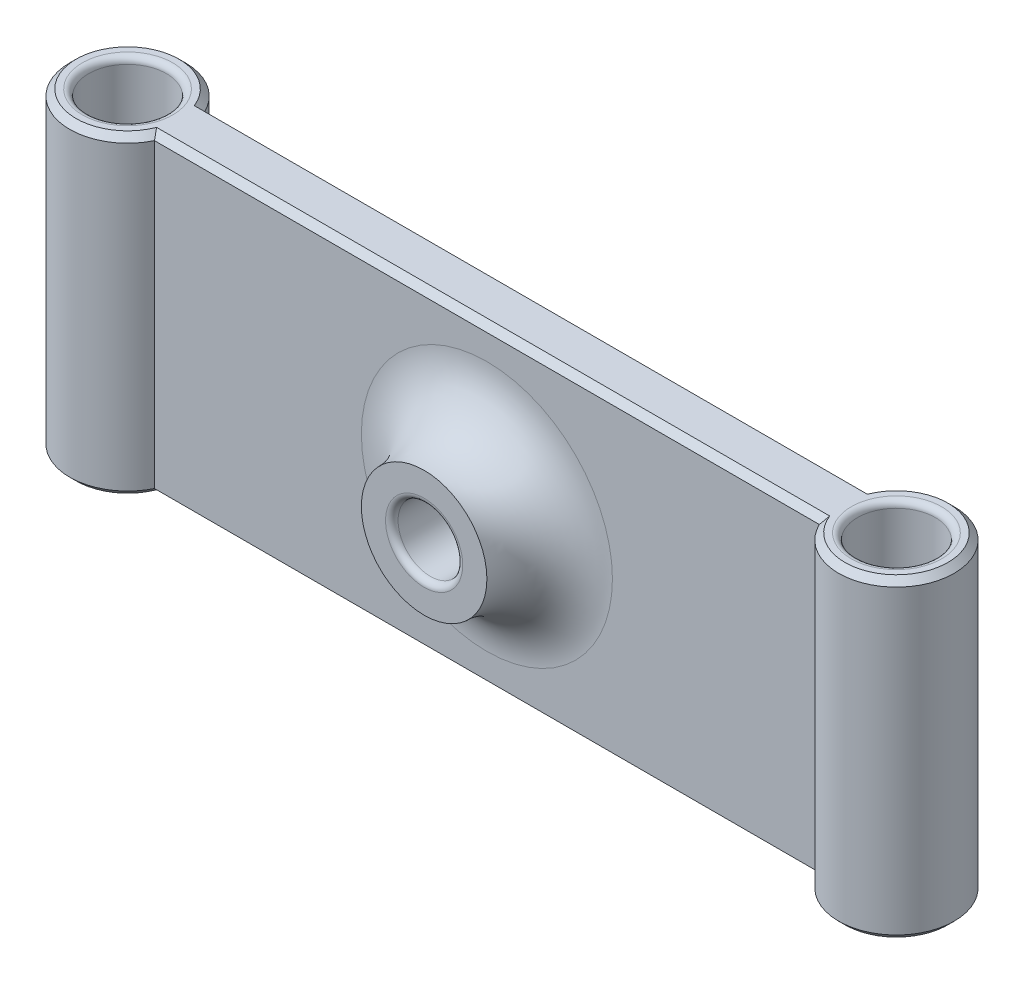
from build123d import *

# Parameters (mm, degrees)
SKETCH1_R                = 6.2
BOSS_EXTRUDE1_DEPTH      = 50
BOSS_EXTRUDE2_DEPTH      = 10
BOSS_EXTRUDE2_DEPTH_BACK = 15
SKETCH2_R                = 10
SKETCH2_R_2              = 5.15
SKETCH3_R                = 5.15
CUT_EXTRUDE2_DEPTH       = 10
FILLET1_R                = 10
FILLET2_R                = 1
CHAMFER1_SIZE            = 1


with BuildPart() as part:
    # Sketch1 → Boss-Extrude1 (new body)
    with BuildSketch(Plane(origin=(0, 0, 0), x_dir=(1, 0, 0), z_dir=(0, 1, 0))):
        with BuildLine():
            Line((-52.965073929, 4), (52.965073929, 4))
            ThreePointArc((52.965073929, 4), (70.45, 0), (52.965073929, -4))
            Line((52.965073929, -4), (-52.965073929, -4))
            ThreePointArc((-52.965073929, -4), (-70.45, 0), (-52.965073929, 4))
        make_face()
        with Locations(Location((-61.25, 0, 0), (0, 0, 270))):
            Circle(SKETCH1_R, mode=Mode.SUBTRACT)
        with Locations(Location((61.25, 0, 0), (0, 0, 90))):
            Circle(SKETCH1_R, mode=Mode.SUBTRACT)
    extrude(amount=BOSS_EXTRUDE1_DEPTH)

    # Sketch2 → Boss-Extrude2 (add, two sides: drawn at the far end of the back side and taken through both)
    with BuildSketch(Plane.XY.offset(4).offset(-BOSS_EXTRUDE2_DEPTH_BACK)):
        with Locations((0, 25)):
            Circle(SKETCH2_R)
        with Locations((0, 25)):
            Circle(SKETCH2_R_2, mode=Mode.SUBTRACT)
    extrude(amount=BOSS_EXTRUDE2_DEPTH + BOSS_EXTRUDE2_DEPTH_BACK)

    # Sketch3 → Cut-Extrude2 (cut)
    with BuildSketch(Plane.XY.offset(4)):
        with Locations((0, 25)):
            Circle(SKETCH3_R)
    extrude(amount=-CUT_EXTRUDE2_DEPTH, mode=Mode.SUBTRACT)

    # Fillet1
    # the kernel refuses this fillet: 10 mm, written as the material it adds along each edge
    with BuildSketch(Plane(origin=(0, 25, 4), x_dir=(1, 0, 0), z_dir=(0, -1, 0))) as fillet1_piece_1:
        with BuildLine():
            CenterArc((10 + FILLET1_R, FILLET1_R), FILLET1_R, 180, 90)
            Line((10, FILLET1_R), (10 - FILLET1_R * 0.02, FILLET1_R))
            Line((10 - FILLET1_R * 0.02, FILLET1_R), (10 - FILLET1_R * 0.02, -FILLET1_R * 0.02))
            Line((10 - FILLET1_R * 0.02, -FILLET1_R * 0.02), (10 + FILLET1_R, -FILLET1_R * 0.02))
            Line((10 + FILLET1_R, -FILLET1_R * 0.02), (10 + FILLET1_R, 0))
        make_face()
    revolve(axis=Axis((0, 25, 4), (0, 0, 1)))
    with BuildSketch(Plane(origin=(0, 25, -4), x_dir=(1, 0, 0), z_dir=(0, -1, 0))) as fillet1_piece_2:
        with BuildLine():
            CenterArc((19.539392014, -10), FILLET1_R, 90, 72.542396876)
            Line((10, -7), (9.80921216, -6.94))
            ThreePointArc((9.80921216, -6.94), (9.8, -3.5), (9.8, 0))
            Line((9.8, 0), (10, 0.2))
            Line((10, 0.2), (19.539392014, 0.2))
            Line((19.539392014, 0.2), (19.539392014, 0))
        make_face()
    revolve(axis=Axis((0, 25, -4), (0, 0, 1)))

    # Fillet2
    fillet2_edges = [part.edges().sort_by_distance(p)[0] for p in [
        (-61.25, 0, -6.2),
        (-61.25, 50, -6.2),
        (61.25, 0, 6.2),
        (61.25, 50, 6.2),
        (-5.15, 25, 14),
        (-5.15, 25, -11),
    ]]
    fillet(fillet2_edges, radius=FILLET2_R)

    # Chamfer1
    chamfer1_edges = [part.edges().sort_by_distance(p)[0] for p in [
        (70.45, 50, 0),
        (0, 50, -4),
        (-70.45, 50, 0),
        (0, 0, -4),
        (70.45, 0, 0),
        (0, 0, 4),
        (-70.45, 0, 0),
        (0, 50, 4),
    ]]
    chamfer(chamfer1_edges, length=CHAMFER1_SIZE)


solid = part.part
